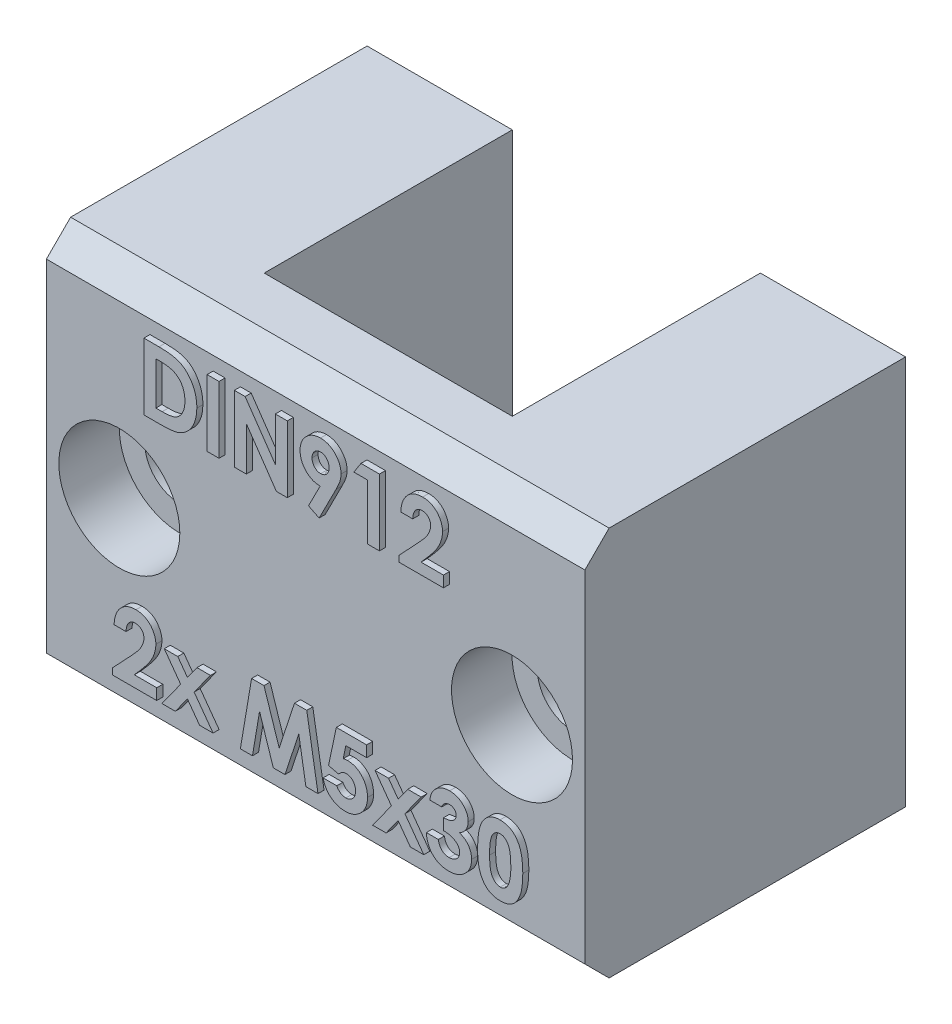
from build123d import *

# Parameters (mm, degrees)
SKETCH1_W                                           = 44.5
SKETCH1_H                                           = 32.2
BOSS_EXTRUDE1_DEPTH                                 = 6
SKETCH2_W                                           = 12
SKETCH2_H                                           = 32.2
BOSS_EXTRUDE2_DEPTH                                 = 20.5
CBORE_FOR_M5_HEX_SOCKET_HEAD_CAP_SCREW1_D           = 5.8
CBORE_FOR_M5_HEX_SOCKET_HEAD_CAP_SCREW1_CBORE_D     = 10
CBORE_FOR_M5_HEX_SOCKET_HEAD_CAP_SCREW1_CBORE_DEPTH = 5
SKETCH6_W                                           = 18.5
SKETCH6_H                                           = 30.2
CUT_EXTRUDE1_DEPTH                                  = 1
CHAMFER1_SIZE                                       = 2
SKETCH7_W                                           = 0.987179487
SKETCH7_H                                           = 5.5
BOSS_EXTRUDE3_DEPTH                                 = 0.5


with BuildPart() as part:
    # Sketch1 → Boss-Extrude1 (new body)
    with BuildSketch(Plane.XY):
        with Locations((22.25, 16.1)):
            Rectangle(SKETCH1_W, SKETCH1_H)
    extrude(amount=BOSS_EXTRUDE1_DEPTH)

    # Sketch2 → Boss-Extrude2 (add)
    with BuildSketch(Plane(origin=(0, 0, 0), x_dir=(-1, 0, 0), z_dir=(0, 0, -1))):
        with Locations((-38.5, 16.1)):
            Rectangle(SKETCH2_W, SKETCH2_H)
        with Locations((-6, 16.1)):
            Rectangle(SKETCH2_W, SKETCH2_H)
    extrude(amount=BOSS_EXTRUDE2_DEPTH)

    # CBORE for M5 Hex Socket Head Cap Screw1 (through all)
    with Locations(Plane.XY.offset(6)):
        with Locations((6.025, 16.1), (38.475, 16.1)):
            CounterBoreHole(CBORE_FOR_M5_HEX_SOCKET_HEAD_CAP_SCREW1_D / 2, CBORE_FOR_M5_HEX_SOCKET_HEAD_CAP_SCREW1_CBORE_D / 2, CBORE_FOR_M5_HEX_SOCKET_HEAD_CAP_SCREW1_CBORE_DEPTH)

    # Sketch6 → Cut-Extrude1 (cut)
    with BuildSketch(Plane(origin=(0, 0, 0), x_dir=(-1, 0, 0), z_dir=(0, 0, -1))):
        with Locations((-22.25, 16.1)):
            Rectangle(SKETCH6_W, SKETCH6_H)
    extrude(amount=-CUT_EXTRUDE1_DEPTH, mode=Mode.SUBTRACT)

    # Chamfer1
    chamfer1_edges = [part.edges().sort_by_distance(p)[0] for p in [
        (22.25, 0, 6),
        (22.25, 32.2, 6),
    ]]
    chamfer(chamfer1_edges, length=CHAMFER1_SIZE)

    # Sketch7 → Boss-Extrude3 (add)
    # profile 1 of 13: a face of its own
    with BuildSketch(Plane.XY.offset(6)):
        with BuildLine():
            Line((8.558580457, 29.075557716), (9.802470681, 29.075557716))
            add(Edge.make_bspline(
                [(9.802470681, 29.075557716), (9.899446232, 29.074879824), (10.086901067, 29.07356945), (10.358486038, 29.058804693), (10.611025501, 29.036097544), (10.844682249, 29.004859746), (11.058977246, 28.963523584), (11.253634165, 28.911675471), (11.429306319, 28.85182545), (11.587919919, 28.781399756), (11.73271888, 28.69929039), (11.870210114, 28.607827149), (12.000123662, 28.503659466), (12.124282653, 28.388796945), (12.241084791, 28.261138209), (12.352475248, 28.122797751), (12.455726682, 27.971769442), (12.55396016, 27.811674467), (12.642799269, 27.641834356), (12.720288059, 27.463694754), (12.785200889, 27.278402056), (12.837945924, 27.085758787), (12.879989805, 26.886404466), (12.909407061, 26.679936812), (12.927593101, 26.466546982), (12.929437923, 26.321922217), (12.930375329, 26.248434319)],
                knots=[0, 0, 0, 0, 1.44355588, 2.790409838, 4.047694926, 5.217575253, 6.298404546, 7.294384826, 8.214239204, 9.058592145, 9.873746385, 10.689560431, 11.514393297, 12.350027578, 13.205127629, 14.088021785, 14.991911688, 15.926770944, 16.882954281, 17.842803888, 18.816321264, 19.80318086, 20.814351908, 21.847355356, 22.906180909, 24, 24, 24, 24], degree=3))
            add(Edge.make_bspline(
                [(12.930375329, 26.248434319), (12.927920695, 26.144738112), (12.923088604, 25.940606058), (12.88238577, 25.641044621), (12.816555505, 25.353885105), (12.723992173, 25.081373785), (12.609238421, 24.825937413), (12.472152214, 24.592080503), (12.314743555, 24.381058279), (12.138846264, 24.193921461), (11.948392339, 24.03307483), (11.750472304, 23.89532146), (11.54315806, 23.786691434), (11.360485237, 23.717803753), (11.20208511, 23.674961575), (11.063011513, 23.649641436), (10.905038096, 23.626421341), (10.726691895, 23.608477351), (10.528755276, 23.592475721), (10.310439262, 23.583781059), (10.072450696, 23.576557085), (9.907145136, 23.575899568), (9.821200649, 23.575557716)],
                knots=[0, 0, 0, 0, 1.315458931, 2.589557908, 3.828601765, 5.048913369, 6.235739168, 7.376350998, 8.481830359, 9.569842114, 10.627874879, 11.640079404, 12.624025415, 13.590060155, 14.111227486, 14.704434459, 15.382649715, 16.137166398, 16.978595427, 17.902333227, 18.909396075, 20, 20, 20, 20], degree=3))
            Line((9.821200649, 23.575557716), (8.558580457, 23.575557716))
            Line((8.558580457, 23.575557716), (8.558580457, 29.075557716))
        make_face()
        with BuildLine():
            Line((9.545759944, 28.088378229), (9.545759944, 24.562737203))
            Line((9.545759944, 24.562737203), (10.061384944, 24.562737203))
            add(Edge.make_bspline(
                [(10.061384944, 24.562737203), (10.1227364, 24.562849625), (10.240735675, 24.563065848), (10.411099916, 24.573364761), (10.568643643, 24.58370203), (10.712933173, 24.603322512), (10.845018601, 24.625178347), (10.96308542, 24.655593736), (11.069567498, 24.687542524), (11.163164179, 24.728217292), (11.248891112, 24.773999451), (11.328264461, 24.827638557), (11.404881965, 24.887202761), (11.477311199, 24.954443932), (11.545826289, 25.028471669), (11.610021857, 25.109667406), (11.670754745, 25.197783411), (11.726466054, 25.293285575), (11.777375346, 25.395165374), (11.822537593, 25.502435954), (11.859983759, 25.615990648), (11.891106721, 25.734766447), (11.913347605, 25.859797429), (11.931747695, 25.990157507), (11.941233478, 26.126363156), (11.942535343, 26.219042033), (11.943195842, 26.266062524)],
                knots=[0, 0, 0, 0, 1.50275155, 2.890291501, 4.180787663, 5.369391935, 6.45668281, 7.458360028, 8.354766181, 9.177074746, 9.954075863, 10.732690366, 11.5210699, 12.329727389, 13.151100085, 13.990027547, 14.863562427, 15.770965086, 16.696477834, 17.652329173, 18.619756807, 19.62365428, 20.657822005, 21.729286259, 22.847956731, 24, 24, 24, 24], degree=3))
            add(Edge.make_bspline(
                [(11.943195842, 26.266062524), (11.941880352, 26.338116982), (11.939315248, 26.478617591), (11.914577947, 26.683259796), (11.874310339, 26.875961089), (11.816852342, 27.056006303), (11.744424757, 27.22390146), (11.65376475, 27.378224133), (11.54877398, 27.52156673), (11.465750143, 27.605656097), (11.424265553, 27.647673101)],
                knots=[0, 0, 0, 0, 1.13821349, 2.219428113, 3.251817212, 4.244760574, 5.201143372, 6.134805572, 7.068016741, 8, 8, 8, 8], degree=3))
            add(Edge.make_bspline(
                [(11.424265553, 27.647673101), (11.383357819, 27.683477269), (11.299808405, 27.756603227), (11.15312309, 27.844226826), (10.99148347, 27.921212746), (10.811191714, 27.982253995), (10.613990264, 28.030528017), (10.398704582, 28.06382143), (10.16648757, 28.085215424), (10.005613035, 28.087301374), (9.922562829, 28.088378229)],
                knots=[0, 0, 0, 0, 0.813307809, 1.661089106, 2.549956539, 3.493439533, 4.508053171, 5.589449661, 6.755572447, 8, 8, 8, 8], degree=3))
            Line((9.922562829, 28.088378229), (9.545759944, 28.088378229))
        make_face(mode=Mode.SUBTRACT)
    # profile 2 of 13: a face of its own
    with BuildSketch(Plane.XY.offset(6)):
        with Locations((14.270118918, 26.325557716)):
            Rectangle(SKETCH7_W, SKETCH7_H)
    # profile 3 of 13: a face of its own
    with BuildSketch(Plane.XY.offset(6)):
        Polygon((16.032939431, 29.075557716), (16.922062027, 29.075557716), (19.417554816, 25.456266851), (19.417554816, 29.075557716), (20.404734303, 29.075557716), (20.404734303, 23.575557716), (19.50900113, 23.575557716), (17.020118919, 27.183830953), (17.020118919, 23.575557716), (16.032939431, 23.575557716), align=None)
    # profile 4 of 13: a face of its own
    with BuildSketch(Plane.XY.offset(6)):
        with BuildLine():
            Line((23.035743919, 23.434532075), (22.160944239, 23.875237203))
            Line((22.160944239, 23.875237203), (23.119477893, 25.761455152))
            add(Edge.make_bspline(
                [(23.119477893, 25.761455152), (23.062845524, 25.762898636), (22.951662483, 25.765732544), (22.787954127, 25.789282293), (22.631403769, 25.829483218), (22.480166194, 25.883000777), (22.33633297, 25.954746609), (22.198160005, 26.040371496), (22.067560079, 26.143248566), (21.943920864, 26.258886646), (21.831034309, 26.386704156), (21.733051168, 26.524169725), (21.64764759, 26.667796254), (21.581233083, 26.820826216), (21.527888613, 26.980407512), (21.488912454, 27.147366153), (21.467040064, 27.322434646), (21.463982923, 27.441584348), (21.462426611, 27.502240409)],
                knots=[0, 0, 0, 0, 1.014336294, 1.991387562, 2.955278539, 3.906441712, 4.859855302, 5.829322156, 6.813833455, 7.833278715, 8.858926674, 9.863225732, 10.85404919, 11.846815163, 12.845559416, 13.865450493, 14.913355531, 16, 16, 16, 16], degree=3))
            add(Edge.make_bspline(
                [(21.462426611, 27.502240409), (21.463870175, 27.56107619), (21.466714689, 27.677010879), (21.490338649, 27.847165275), (21.529217574, 28.010538353), (21.582558065, 28.167102361), (21.653567833, 28.315801558), (21.73668296, 28.45896423), (21.838287431, 28.593628495), (21.953065917, 28.720377315), (22.078684878, 28.836330106), (22.211956052, 28.938280945), (22.352273473, 29.023502051), (22.497833924, 29.095072058), (22.651268515, 29.148544715), (22.810359945, 29.188889439), (22.976293339, 29.21217411), (23.088925467, 29.215101847), (23.145920201, 29.216583357)],
                knots=[0, 0, 0, 0, 1.055538678, 2.079917126, 3.075849687, 4.065898488, 5.041806164, 6.028602842, 7.031727914, 8.062953097, 9.093756959, 10.095582084, 11.068815425, 12.035667573, 13.000833448, 13.979119574, 14.977382875, 16, 16, 16, 16], degree=3))
            add(Edge.make_bspline(
                [(23.145920201, 29.216583357), (23.20551509, 29.215356661), (23.322700375, 29.212944528), (23.494243897, 29.186327599), (23.658369794, 29.14549236), (23.815744939, 29.090029775), (23.964415584, 29.014755568), (24.105625728, 28.924538906), (24.238905663, 28.817383686), (24.362824059, 28.696378455), (24.475526456, 28.564762626), (24.575423107, 28.426992605), (24.659340535, 28.28333777), (24.728074042, 28.135080192), (24.781617098, 27.981987608), (24.818421125, 27.823842861), (24.842854917, 27.660916387), (24.845634995, 27.550440197), (24.847041995, 27.494528069)],
                knots=[0, 0, 0, 0, 1.062826075, 2.08990367, 3.089830715, 4.078784409, 5.060762809, 6.057138927, 7.064407536, 8.107320944, 9.143871033, 10.153461498, 11.140480137, 12.108246174, 13.065926856, 14.029354859, 15.002654194, 16, 16, 16, 16], degree=3))
            add(Edge.make_bspline(
                [(24.847041995, 27.494528069), (24.846274182, 27.451885216), (24.844727633, 27.365992922), (24.829520792, 27.237188118), (24.806448948, 27.108026318), (24.779669191, 26.999433279), (24.75159434, 26.907895943), (24.724274313, 26.830243489), (24.689221915, 26.744034686), (24.650082408, 26.648691695), (24.604754253, 26.544632607), (24.552297654, 26.432354864), (24.495882943, 26.310193275), (24.454299732, 26.226660846), (24.432779175, 26.183430312)],
                knots=[0, 0, 0, 0, 1.105131805, 2.225983929, 3.357782449, 4.505488967, 5.122909461, 5.839607681, 6.638776516, 7.535249922, 8.51168636, 9.581005249, 10.748097757, 12, 12, 12, 12], degree=3))
            Line((24.432779175, 26.183430312), (23.035743919, 23.434532075))
        make_face()
        with BuildLine():
            add(Edge.make_bspline(
                [(23.167955457, 26.678121819), (23.215256985, 26.680906597), (23.307673461, 26.686347423), (23.440423583, 26.728417047), (23.559228193, 26.800409599), (23.664529031, 26.896052663), (23.751546421, 27.012741576), (23.814813757, 27.145581531), (23.853784489, 27.291821559), (23.857797584, 27.393653336), (23.859862508, 27.446050505)],
                knots=[0, 0, 0, 0, 0.984774978, 1.924027336, 2.867853169, 3.859505234, 4.871392407, 5.881338128, 6.909850265, 8, 8, 8, 8], degree=3))
            add(Edge.make_bspline(
                [(23.859862508, 27.446050505), (23.857375533, 27.499537656), (23.852537771, 27.603582935), (23.813193716, 27.753333284), (23.745962639, 27.888698718), (23.654498604, 28.006368558), (23.547715536, 28.104843182), (23.428305112, 28.176776243), (23.299166866, 28.221257342), (23.209798681, 28.22666961), (23.164650169, 28.22940387)],
                knots=[0, 0, 0, 0, 1.104110315, 2.147758178, 3.172670271, 4.206310416, 5.210906102, 6.157051016, 7.068948237, 8, 8, 8, 8], degree=3))
            add(Edge.make_bspline(
                [(23.164650169, 28.22940387), (23.116930725, 28.226738319), (23.023233987, 28.221504533), (22.888835053, 28.177130251), (22.764940334, 28.106578545), (22.656745891, 28.007769801), (22.56310775, 27.891649635), (22.497811318, 27.755827282), (22.456502531, 27.60712195), (22.451946243, 27.502890084), (22.449606098, 27.449355793)],
                knots=[0, 0, 0, 0, 0.970967322, 1.90648639, 2.855811969, 3.858352357, 4.877096915, 5.878517833, 6.91039038, 8, 8, 8, 8], degree=3))
            add(Edge.make_bspline(
                [(22.449606098, 27.449355793), (22.452050524, 27.396584594), (22.456804677, 27.293950122), (22.496649316, 27.14688071), (22.561552239, 27.013337754), (22.650279165, 26.895728583), (22.759568888, 26.799614275), (22.883658955, 26.728388589), (23.022078554, 26.686233351), (23.118454507, 26.680874335), (23.167955457, 26.678121819)],
                knots=[0, 0, 0, 0, 1.075706617, 2.092137047, 3.084482865, 4.090466434, 5.0784141, 6.035155512, 6.990809768, 8, 8, 8, 8], degree=3))
        make_face(mode=Mode.SUBTRACT)
    # profile 5 of 13: a face of its own
    with BuildSketch(Plane.XY.offset(6)):
        Polygon((26.494177412, 29.075557716), (28.020118919, 29.075557716), (28.020118919, 23.575557716), (27.032939431, 23.575557716), (27.032939431, 28.15889105), (25.904734303, 28.15889105), align=None)
    # profile 6 of 13: a face of its own
    with BuildSketch(Plane.XY.offset(6)):
        with BuildLine():
            Line((30.770118919, 27.242224383), (29.782939431, 27.242224383))
            add(Edge.make_bspline(
                [(29.782939431, 27.242224383), (29.787202908, 27.316899288), (29.795533486, 27.462809571), (29.828670418, 27.674748927), (29.873072771, 27.875008314), (29.932333605, 28.0628872), (30.00679872, 28.238317319), (30.094551937, 28.401896719), (30.197835152, 28.552764152), (30.314450157, 28.69019205), (30.442417152, 28.813479886), (30.579079415, 28.922794626), (30.72652738, 29.012998399), (30.882067052, 29.087227753), (31.045671946, 29.146533557), (31.218890021, 29.186184286), (31.400221462, 29.213036149), (31.524357516, 29.215385795), (31.587626931, 29.216583357)],
                knots=[0, 0, 0, 0, 1.199038563, 2.342849363, 3.436047546, 4.486744587, 5.497670872, 6.488682221, 7.459191391, 8.424610317, 9.374430501, 10.305433194, 11.225809216, 12.140057399, 13.06607119, 14.010487599, 14.985989317, 16, 16, 16, 16], degree=3))
            add(Edge.make_bspline(
                [(31.587626931, 29.216583357), (31.665289241, 29.214160088), (31.816904268, 29.2094293), (32.037212929, 29.169074103), (32.242957131, 29.101573801), (32.433987317, 29.007258078), (32.608677213, 28.887439838), (32.76699785, 28.744576196), (32.904161362, 28.575669799), (33.021037403, 28.387748565), (33.118147425, 28.188766426), (33.186198084, 27.983010644), (33.230927049, 27.775941141), (33.23569767, 27.636511018), (33.238067636, 27.567244415)],
                knots=[0, 0, 0, 0, 1.075374347, 2.099382735, 3.09057751, 4.06680945, 5.040638231, 6.016817125, 7.011024321, 8.044445721, 9.0776792, 10.070479129, 11.0414456, 12, 12, 12, 12], degree=3))
            add(Edge.make_bspline(
                [(33.238067636, 27.567244415), (33.237144897, 27.525347078), (33.235287649, 27.441018087), (33.222373963, 27.313407626), (33.20300088, 27.183421452), (33.173790994, 27.051171017), (33.137363871, 26.916619247), (33.093172505, 26.779363477), (33.040191835, 26.640181895), (32.979306, 26.497508037), (32.906669044, 26.350878697), (32.822093406, 26.198095843), (32.723334256, 26.039295007), (32.611584481, 25.873579547), (32.486301337, 25.701210822), (32.346873236, 25.52270806), (32.19490606, 25.337442275), (32.08705068, 25.213602494), (32.031637348, 25.149976787)],
                knots=[0, 0, 0, 0, 0.728284026, 1.46585585, 2.227944881, 3.01186502, 3.81876927, 4.650621989, 5.517437689, 6.406905708, 7.346299482, 8.360816762, 9.441613733, 10.596154504, 11.834900912, 13.145207542, 14.533280747, 16, 16, 16, 16], degree=3))
            Line((32.031637348, 25.149976787), (31.457618919, 24.492224383))
            Line((31.457618919, 24.492224383), (33.308580457, 24.492224383))
            Line((33.308580457, 24.492224383), (33.308580457, 23.575557716))
            Line((33.308580457, 23.575557716), (29.64191379, 23.575557716))
            Line((29.64191379, 23.575557716), (29.64191379, 24.075758037))
            Line((29.64191379, 24.075758037), (31.270319239, 25.808830953))
            add(Edge.make_bspline(
                [(31.270319239, 25.808830953), (31.317465761, 25.859385229), (31.408774594, 25.957293867), (31.538697652, 26.10108312), (31.656266544, 26.237535688), (31.759043381, 26.368104517), (31.85242176, 26.488554485), (31.932237948, 26.602516104), (31.999222198, 26.70895912), (32.071943102, 26.837310808), (32.141004056, 26.990393036), (32.204371661, 27.166750039), (32.242998602, 27.335306718), (32.248330341, 27.445141874), (32.250888149, 27.497833357)],
                knots=[0, 0, 0, 0, 1.246127091, 2.413378631, 3.493388633, 4.492180848, 5.408488754, 6.240484944, 6.999099869, 7.674939598, 8.898438119, 10.020720584, 11.050475521, 12, 12, 12, 12], degree=3))
            add(Edge.make_bspline(
                [(32.250888149, 27.497833357), (32.248975738, 27.548808302), (32.245270134, 27.647580431), (32.204548553, 27.788083259), (32.141461268, 27.915294226), (32.052562373, 28.025412127), (31.944877968, 28.115903307), (31.820438523, 28.183208105), (31.680258586, 28.222042665), (31.581989779, 28.226903364), (31.531437027, 28.22940387)],
                knots=[0, 0, 0, 0, 1.062038974, 2.057870785, 3.028805853, 4.01125022, 4.991535629, 5.949134679, 6.94496649, 8, 8, 8, 8], degree=3))
            add(Edge.make_bspline(
                [(31.531437027, 28.22940387), (31.505320832, 28.228480153), (31.453906908, 28.226661668), (31.378332458, 28.214556506), (31.306417939, 28.193222421), (31.237362902, 28.16463775), (31.171904322, 28.126748564), (31.110207305, 28.080044105), (31.051621796, 28.025711241), (30.99641649, 27.963919862), (30.946172456, 27.894960664), (30.901545888, 27.81946345), (30.864647145, 27.737475083), (30.832160151, 27.650077934), (30.807104627, 27.556333286), (30.788861097, 27.456802191), (30.774991759, 27.351646573), (30.771772747, 27.279361974), (30.770118919, 27.242224383)],
                knots=[0, 0, 0, 0, 0.903469896, 1.778625579, 2.63899355, 3.493148037, 4.358286772, 5.247621495, 6.164656832, 7.118446693, 8.109501108, 9.111810964, 10.146451449, 11.215617525, 12.33435995, 13.498009769, 14.714554818, 16, 16, 16, 16], degree=3))
        make_face()
    # profile 7 of 13: a face of its own
    with BuildSketch(Plane.XY.offset(6)):
        with BuildLine():
            Line((7.077811226, 7.331967973), (6.090631739, 7.331967973))
            add(Edge.make_bspline(
                [(6.090631739, 7.331967973), (6.094895216, 7.406642878), (6.103225794, 7.55255316), (6.136362726, 7.764492517), (6.180765078, 7.964751903), (6.240025912, 8.15263079), (6.314491027, 8.328060908), (6.402244245, 8.491640309), (6.505527459, 8.642507742), (6.622142465, 8.77993564), (6.75010946, 8.903223476), (6.886771723, 9.012538216), (7.034219688, 9.102741989), (7.18975936, 9.176971342), (7.353364254, 9.236277147), (7.526582329, 9.275927876), (7.707913769, 9.302779739), (7.832049824, 9.305129384), (7.895319239, 9.306326947)],
                knots=[0, 0, 0, 0, 1.199038563, 2.342849363, 3.436047546, 4.486744587, 5.497670872, 6.488682221, 7.459191391, 8.424610317, 9.374430501, 10.305433194, 11.225809216, 12.140057399, 13.06607119, 14.010487599, 14.985989317, 16, 16, 16, 16], degree=3))
            add(Edge.make_bspline(
                [(7.895319239, 9.306326947), (7.972981548, 9.303903678), (8.124596576, 9.29917289), (8.344905237, 9.258817693), (8.550649439, 9.191317391), (8.741679624, 9.097001668), (8.91636952, 8.977183427), (9.074690158, 8.834319786), (9.211853669, 8.665413388), (9.328729711, 8.477492155), (9.425839733, 8.278510016), (9.493890391, 8.072754233), (9.538619357, 7.865684731), (9.543389978, 7.726254608), (9.545759944, 7.656988005)],
                knots=[0, 0, 0, 0, 1.075374347, 2.099382735, 3.09057751, 4.06680945, 5.040638231, 6.016817125, 7.011024321, 8.044445721, 9.0776792, 10.070479129, 11.0414456, 12, 12, 12, 12], degree=3))
            add(Edge.make_bspline(
                [(9.545759944, 7.656988005), (9.544837204, 7.615090667), (9.542979957, 7.530761676), (9.53006627, 7.403151216), (9.510693188, 7.273165042), (9.481483302, 7.140914607), (9.445056178, 7.006362837), (9.400864813, 6.869107066), (9.347884142, 6.729925484), (9.286998307, 6.587251626), (9.214361352, 6.440622286), (9.129785714, 6.287839433), (9.031026564, 6.129038597), (8.919276788, 5.963323137), (8.793993645, 5.790954412), (8.654565543, 5.61245165), (8.502598367, 5.427185865), (8.394742988, 5.303346084), (8.339329656, 5.239720376)],
                knots=[0, 0, 0, 0, 0.728284026, 1.46585585, 2.227944881, 3.01186502, 3.81876927, 4.650621989, 5.517437689, 6.406905708, 7.346299482, 8.360816762, 9.441613733, 10.596154504, 11.834900912, 13.145207542, 14.533280747, 16, 16, 16, 16], degree=3))
            Line((8.339329656, 5.239720376), (7.765311226, 4.581967973))
            Line((7.765311226, 4.581967973), (9.616272765, 4.581967973))
            Line((9.616272765, 4.581967973), (9.616272765, 3.665301306))
            Line((9.616272765, 3.665301306), (5.949606098, 3.665301306))
            Line((5.949606098, 3.665301306), (5.949606098, 4.165501626))
            Line((5.949606098, 4.165501626), (7.578011547, 5.898574543))
            add(Edge.make_bspline(
                [(7.578011547, 5.898574543), (7.625158069, 5.949128818), (7.716466901, 6.047037457), (7.84638996, 6.190826709), (7.963958851, 6.327279278), (8.066735689, 6.457848107), (8.160114068, 6.578298074), (8.239930255, 6.692259694), (8.306914506, 6.79870271), (8.37963541, 6.927054398), (8.448696364, 7.080136626), (8.512063969, 7.256493629), (8.550690909, 7.425050308), (8.556022649, 7.534885463), (8.558580457, 7.587576947)],
                knots=[0, 0, 0, 0, 1.246127091, 2.413378631, 3.493388633, 4.492180848, 5.408488754, 6.240484944, 6.999099869, 7.674939598, 8.898438119, 10.020720584, 11.050475521, 12, 12, 12, 12], degree=3))
            add(Edge.make_bspline(
                [(8.558580457, 7.587576947), (8.556668046, 7.638551892), (8.552962442, 7.737324021), (8.512240861, 7.877826849), (8.449153576, 8.005037816), (8.360254681, 8.115155716), (8.252570276, 8.205646897), (8.128130831, 8.272951695), (7.987950893, 8.311786254), (7.889682086, 8.316646954), (7.839129335, 8.31914746)],
                knots=[0, 0, 0, 0, 1.062038974, 2.057870785, 3.028805853, 4.01125022, 4.991535629, 5.949134679, 6.94496649, 8, 8, 8, 8], degree=3))
            add(Edge.make_bspline(
                [(7.839129335, 8.31914746), (7.81301314, 8.318223743), (7.761599216, 8.316405258), (7.686024765, 8.304300096), (7.614110246, 8.282966011), (7.54505521, 8.25438134), (7.47959663, 8.216492154), (7.417899613, 8.169787695), (7.359314104, 8.11545483), (7.304108798, 8.053663451), (7.253864763, 7.984704254), (7.209238195, 7.90920704), (7.172339453, 7.827218673), (7.139852459, 7.739821523), (7.114796935, 7.646076876), (7.096553405, 7.546545781), (7.082684067, 7.441390163), (7.079465055, 7.369105564), (7.077811226, 7.331967973)],
                knots=[0, 0, 0, 0, 0.903469896, 1.778625579, 2.63899355, 3.493148037, 4.358286772, 5.247621495, 6.164656832, 7.118446693, 8.109501108, 9.111810964, 10.146451449, 11.215617525, 12.33435995, 13.498009769, 14.714554818, 16, 16, 16, 16], degree=3))
        make_face()
    # profile 8 of 13: a face of its own
    with BuildSketch(Plane.XY.offset(6)):
        Polygon((10.240972284, 7.684532075), (11.354854495, 7.684532075), (12.149225489, 6.589379832), (12.940291194, 7.684532075), (14.054173406, 7.684532075), (12.707819239, 5.81924762), (14.270118919, 3.665301306), (13.156236707, 3.665301306), (12.152530777, 5.049115409), (11.153231899, 3.665301306), (10.039349688, 3.665301306), (11.593937027, 5.81924762), align=None)
    # profile 9 of 13: a face of its own
    with BuildSketch(Plane.XY.offset(6)):
        Polygon((17.455315233, 9.165301306), (18.479954656, 9.165301306), (19.734862508, 5.328963165), (20.998584463, 9.165301306), (22.013308021, 9.165301306), (22.943195842, 3.665301306), (21.943896963, 3.665301306), (21.35665738, 7.139159479), (20.213027572, 3.665301306), (19.250086867, 3.665301306), (18.113067636, 7.139159479), (17.526929816, 3.665301306), (16.526529175, 3.665301306), align=None)
    # profile 10 of 13: a face of its own
    with BuildSketch(Plane.XY.offset(6)):
        with BuildLine():
            Line((24.45811972, 9.165301306), (26.962426611, 9.165301306))
            Line((26.962426611, 9.165301306), (26.962426611, 8.248634639))
            Line((26.962426611, 8.248634639), (25.240371322, 8.248634639))
            Line((25.240371322, 8.248634639), (25.025527572, 7.208570537))
            add(Edge.make_bspline(
                [(25.025527572, 7.208570537), (25.054803109, 7.216724143), (25.112540481, 7.23280473), (25.199521905, 7.248931525), (25.283819026, 7.2593844), (25.339134282, 7.260778674), (25.365972284, 7.261455152)],
                knots=[0, 0, 0, 0, 1.05461699, 2.079921384, 3.068411212, 4, 4, 4, 4], degree=3))
            add(Edge.make_bspline(
                [(25.365972284, 7.261455152), (25.424455101, 7.260115052), (25.539737615, 7.25747342), (25.708381305, 7.232395716), (25.869867601, 7.192899092), (26.023702337, 7.136568756), (26.169735237, 7.06325337), (26.308143321, 6.974562305), (26.439096462, 6.870339786), (26.560268381, 6.750520562), (26.671606203, 6.618956342), (26.768408088, 6.476655716), (26.851082939, 6.325647754), (26.916839657, 6.164993793), (26.968740465, 5.995702849), (27.006245148, 5.817666434), (27.02842354, 5.630673548), (27.03141416, 5.503101672), (27.032939431, 5.438037684)],
                knots=[0, 0, 0, 0, 1.01440847, 1.999622559, 2.951875003, 3.895578053, 4.836219714, 5.782137149, 6.743708247, 7.735272588, 8.734977101, 9.730283169, 10.717124674, 11.717316708, 12.737475749, 13.78628267, 14.87096371, 16, 16, 16, 16], degree=3))
            add(Edge.make_bspline(
                [(27.032939431, 5.438037684), (27.031075526, 5.372235069), (27.027397495, 5.242387275), (27.003401715, 5.051465087), (26.961048732, 4.868604732), (26.902872673, 4.693316697), (26.826229439, 4.526889308), (26.73405546, 4.367598501), (26.624792323, 4.216626641), (26.499512274, 4.075521372), (26.363316428, 3.946548447), (26.218300001, 3.833090718), (26.065481779, 3.737616959), (25.904858073, 3.66045802), (25.737350433, 3.599411241), (25.56290802, 3.5549721), (25.380683064, 3.529488721), (25.256975995, 3.526032445), (25.194097284, 3.524275665)],
                knots=[0, 0, 0, 0, 1.06808661, 2.107647099, 3.116961351, 4.110378221, 5.100014249, 6.085620622, 7.093190682, 8.119403071, 9.144090782, 10.133780668, 11.103064255, 12.062861538, 13.020824475, 13.992378307, 14.979551724, 16, 16, 16, 16], degree=3))
            add(Edge.make_bspline(
                [(25.194097284, 3.524275665), (25.137866724, 3.525712821), (25.026968293, 3.528547193), (24.863619772, 3.545968737), (24.706133658, 3.576770192), (24.555346031, 3.621347871), (24.409670352, 3.676212818), (24.270790674, 3.744831802), (24.13794383, 3.825898226), (24.011507053, 3.917932626), (23.893534763, 4.021605808), (23.785862157, 4.135093968), (23.687837372, 4.256966643), (23.601557984, 4.388727371), (23.527294454, 4.530181484), (23.46143604, 4.679661913), (23.407530268, 4.838729709), (23.380174642, 4.949004343), (23.366272765, 5.005044896)],
                knots=[0, 0, 0, 0, 1.054957082, 2.080596141, 3.077793124, 4.061112343, 5.027190972, 5.994718051, 6.962465889, 7.943658696, 8.924948258, 9.904494768, 10.875059, 11.855380583, 12.854004648, 13.869083016, 14.917087635, 16, 16, 16, 16], degree=3))
            Line((23.366272765, 5.005044896), (24.494477893, 5.005044896))
            add(Edge.make_bspline(
                [(24.494477893, 5.005044896), (24.51510151, 4.966211075), (24.555181156, 4.890741976), (24.631421503, 4.790545408), (24.716767732, 4.705102079), (24.810449973, 4.633577189), (24.913075228, 4.579991959), (25.020461712, 4.5393554), (25.133958477, 4.515873037), (25.211254785, 4.512937509), (25.250287188, 4.511455152)],
                knots=[0, 0, 0, 0, 1.104910296, 2.147267069, 3.153527244, 4.136738762, 5.099945312, 6.05603338, 7.018353, 8, 8, 8, 8], degree=3))
            add(Edge.make_bspline(
                [(25.250287188, 4.511455152), (25.277492249, 4.512478732), (25.331018666, 4.514492644), (25.409881376, 4.525146742), (25.485159298, 4.545325362), (25.557412105, 4.573268061), (25.626833886, 4.608115761), (25.692429455, 4.652108713), (25.755340059, 4.702746231), (25.814607941, 4.760852955), (25.86828756, 4.825628436), (25.915358713, 4.895234106), (25.957446815, 4.968123312), (25.988622116, 5.047183379), (26.014152052, 5.130053544), (26.032953329, 5.217358924), (26.044189212, 5.309201483), (26.045229354, 5.371899823), (26.045759944, 5.403883037)],
                knots=[0, 0, 0, 0, 0.978869489, 1.925942215, 2.855067702, 3.774946051, 4.70828698, 5.642468714, 6.60995405, 7.609372294, 8.622401667, 9.629904756, 10.629323, 11.642352373, 12.678539694, 13.745912462, 14.850161547, 16, 16, 16, 16], degree=3))
            add(Edge.make_bspline(
                [(26.045759944, 5.403883037), (26.045144133, 5.435123847), (26.043945443, 5.495934843), (26.034029636, 5.585227168), (26.016290449, 5.669949424), (25.992120654, 5.750750521), (25.961180432, 5.827139795), (25.923369411, 5.899571953), (25.878526061, 5.967680876), (25.826409626, 6.030079934), (25.770833195, 6.087314124), (25.711126251, 6.137370691), (25.64782672, 6.178914166), (25.582901558, 6.215182828), (25.513759186, 6.24157837), (25.441954338, 6.259756006), (25.367562526, 6.273094023), (25.316821486, 6.273877681), (25.291052412, 6.274275665)],
                knots=[0, 0, 0, 0, 1.166249705, 2.270133367, 3.348514167, 4.393962215, 5.415026464, 6.420877785, 7.440098956, 8.453121383, 9.451844239, 10.415694839, 11.355045125, 12.27538808, 13.187007209, 14.108269027, 15.039275622, 16, 16, 16, 16], degree=3))
            add(Edge.make_bspline(
                [(25.291052412, 6.274275665), (25.263061209, 6.273213554), (25.206960833, 6.271084857), (25.123609716, 6.253764213), (25.041263582, 6.225732914), (24.959464501, 6.187059294), (24.879024471, 6.136447729), (24.797820641, 6.077086166), (24.718571076, 6.004661424), (24.668181999, 5.950719312), (24.642114111, 5.922813325)],
                knots=[0, 0, 0, 0, 0.88288272, 1.769486374, 2.674910571, 3.623812639, 4.617874466, 5.670434592, 6.794841017, 8, 8, 8, 8], degree=3))
            Line((24.642114111, 5.922813325), (23.811384944, 6.113418293))
            Line((23.811384944, 6.113418293), (24.45811972, 9.165301306))
        make_face()
    # profile 11 of 13: a face of its own
    with BuildSketch(Plane.XY.offset(6)):
        Polygon((27.657638951, 7.684532075), (28.771521162, 7.684532075), (29.565892156, 6.589379832), (30.356957861, 7.684532075), (31.470840072, 7.684532075), (30.124485906, 5.81924762), (31.686785585, 3.665301306), (30.572903374, 3.665301306), (29.569197444, 5.049115409), (28.569898566, 3.665301306), (27.456016354, 3.665301306), (29.010603694, 5.81924762), align=None)
    # profile 12 of 13: a face of its own
    with BuildSketch(Plane.XY.offset(6)):
        with BuildLine():
            Line((33.167554816, 7.825557716), (32.180375329, 7.825557716))
            add(Edge.make_bspline(
                [(32.180375329, 7.825557716), (32.187345191, 7.874903297), (32.201009145, 7.97164204), (32.23370516, 8.11169564), (32.272813121, 8.244546065), (32.321637413, 8.369772604), (32.378900365, 8.487598327), (32.444019675, 8.598427555), (32.517699309, 8.701784588), (32.574175529, 8.764047275), (32.602350489, 8.795108998)],
                knots=[0, 0, 0, 0, 1.111473889, 2.178970933, 3.205615836, 4.199322666, 5.174200091, 6.12565194, 7.064921805, 8, 8, 8, 8], degree=3))
            add(Edge.make_bspline(
                [(32.602350489, 8.795108998), (32.642989136, 8.836092691), (32.723083637, 8.916867243), (32.856930943, 9.020330522), (32.997227637, 9.109870954), (33.146787433, 9.180859256), (33.303283066, 9.238316062), (33.467959045, 9.276909929), (33.640142443, 9.3025173), (33.757635952, 9.305039716), (33.81759488, 9.306326947)],
                knots=[0, 0, 0, 0, 1.01925491, 2.00884431, 2.983262333, 3.955970413, 4.92937149, 5.924503185, 6.940838805, 8, 8, 8, 8], degree=3))
            add(Edge.make_bspline(
                [(33.81759488, 9.306326947), (33.870901452, 9.305068483), (33.975691432, 9.302594597), (34.129706335, 9.282735582), (34.276546656, 9.247905081), (34.41776454, 9.202364983), (34.551283132, 9.140400069), (34.680049317, 9.068471992), (34.800465363, 8.980249216), (34.912813022, 8.880566358), (35.016025773, 8.772749589), (35.105408468, 8.657502329), (35.182252375, 8.537903099), (35.24556159, 8.412958256), (35.294237773, 8.282456376), (35.328020488, 8.147151353), (35.350132095, 8.007341747), (35.352334989, 7.912315041), (35.353452252, 7.864119415)],
                knots=[0, 0, 0, 0, 1.091422571, 2.145516843, 3.172569842, 4.178562979, 5.178154469, 6.181868002, 7.194278174, 8.227918432, 9.254613415, 10.245994977, 11.209837596, 12.161663635, 13.10878368, 14.055455738, 15.013766427, 16, 16, 16, 16], degree=3))
            add(Edge.make_bspline(
                [(35.353452252, 7.864119415), (35.351159561, 7.804433145), (35.346645957, 7.686929231), (35.309608572, 7.514953523), (35.251634992, 7.350514055), (35.167886517, 7.195911583), (35.063179593, 7.051566849), (34.934707704, 6.922305731), (34.786130062, 6.806101588), (34.674590848, 6.743653468), (34.617474688, 6.711675505)],
                knots=[0, 0, 0, 0, 0.992805628, 1.954529043, 2.915727527, 3.886831945, 4.871318353, 5.87440735, 6.911542536, 8, 8, 8, 8], degree=3))
            add(Edge.make_bspline(
                [(34.617474688, 6.711675505), (34.656678344, 6.698804119), (34.73371177, 6.673512423), (34.843205523, 6.623700715), (34.94732157, 6.569264774), (35.044267071, 6.50602456), (35.135006266, 6.436537228), (35.218985997, 6.360208774), (35.296708025, 6.27720563), (35.366903569, 6.187071311), (35.429204857, 6.091247339), (35.485104485, 5.991947191), (35.531112995, 5.887664962), (35.570087931, 5.779591627), (35.599761228, 5.666755878), (35.62065388, 5.549594946), (35.632730346, 5.428376081), (35.634572213, 5.346250373), (35.635503534, 5.304724383)],
                knots=[0, 0, 0, 0, 1.059543567, 2.081955587, 3.086750234, 4.076226789, 5.052108497, 6.020845489, 6.989030705, 7.970690546, 8.952259656, 9.923888338, 10.895517021, 11.877585046, 12.873342345, 13.889638361, 14.932918083, 16, 16, 16, 16], degree=3))
            add(Edge.make_bspline(
                [(35.635503534, 5.304724383), (35.633615622, 5.243698037), (35.629893045, 5.123366511), (35.606226639, 4.946130489), (35.562164057, 4.777151687), (35.504197289, 4.614485752), (35.426875912, 4.46023264), (35.33588165, 4.310852453), (35.224031419, 4.171525655), (35.099729094, 4.038568807), (34.961684114, 3.917690394), (34.812020898, 3.812894249), (34.654030413, 3.722960511), (34.486713096, 3.64994974), (34.310127078, 3.593723096), (34.124665953, 3.553079886), (33.929550464, 3.528213698), (33.796368878, 3.52560695), (33.728352092, 3.524275665)],
                knots=[0, 0, 0, 0, 1.005138573, 1.981928558, 2.936866704, 3.876260664, 4.820238198, 5.773547, 6.751179199, 7.756627054, 8.768222608, 9.766606018, 10.760583154, 11.757261445, 12.767156078, 13.807575856, 14.880313354, 16, 16, 16, 16], degree=3))
            add(Edge.make_bspline(
                [(33.728352092, 3.524275665), (33.664009309, 3.52567928), (33.538195512, 3.528423863), (33.354166502, 3.552179622), (33.179264348, 3.590499589), (33.013042696, 3.64451476), (32.856144645, 3.714563207), (32.707147381, 3.797975189), (32.569024114, 3.899561716), (32.440235877, 4.014736981), (32.323639582, 4.143957088), (32.219429952, 4.284228718), (32.129904827, 4.436085267), (32.054697065, 4.59887794), (31.994394619, 4.772892325), (31.946828227, 4.957774553), (31.913602324, 5.153885829), (31.903483305, 5.288814559), (31.898324047, 5.357608998)],
                knots=[0, 0, 0, 0, 1.066544725, 2.085487077, 3.070979577, 4.031932826, 4.977951092, 5.916076795, 6.857635327, 7.814973522, 8.776389752, 9.738577119, 10.707772778, 11.69409279, 12.707140348, 13.757286496, 14.856535458, 16, 16, 16, 16], degree=3))
            Line((31.898324047, 5.357608998), (32.885503534, 5.357608998))
            add(Edge.make_bspline(
                [(32.885503534, 5.357608998), (32.891759187, 5.323018251), (32.903943713, 5.2556437), (32.927708883, 5.158100327), (32.958678215, 5.068061769), (32.994486468, 4.984727766), (33.033164773, 4.907004171), (33.079897413, 4.837761509), (33.131260068, 4.775119558), (33.205376754, 4.700650116), (33.311331661, 4.624135873), (33.454405888, 4.557641356), (33.613562417, 4.5186674), (33.724828703, 4.513912697), (33.78233847, 4.511455152)],
                knots=[0, 0, 0, 0, 0.928156231, 1.807827665, 2.648129825, 3.438902246, 4.202261636, 4.936546065, 5.639352463, 6.338805438, 7.70633318, 9.064371875, 10.482673459, 12, 12, 12, 12], degree=3))
            add(Edge.make_bspline(
                [(33.78233847, 4.511455152), (33.812855185, 4.511978463), (33.872630603, 4.513003512), (33.960431791, 4.524364809), (34.044074785, 4.543076874), (34.123715375, 4.568505876), (34.199860557, 4.600382721), (34.271055501, 4.641486004), (34.338751339, 4.689274439), (34.402212155, 4.743001326), (34.460851256, 4.8015444), (34.509642438, 4.866370909), (34.554234047, 4.932246228), (34.587214322, 5.003480154), (34.616112148, 5.07623954), (34.633799094, 5.153165323), (34.647154009, 5.232643808), (34.647930143, 5.287035394), (34.648324047, 5.314640248)],
                knots=[0, 0, 0, 0, 1.110435564, 2.175094844, 3.216326037, 4.226890168, 5.215276772, 6.21526065, 7.213097102, 8.228249917, 9.239874822, 10.221364777, 11.178138315, 12.128914389, 13.072518965, 14.022636769, 14.996447288, 16, 16, 16, 16], degree=3))
            add(Edge.make_bspline(
                [(34.648324047, 5.314640248), (34.647278305, 5.344830859), (34.645196473, 5.404933449), (34.62818769, 5.49264054), (34.601327225, 5.577007693), (34.564014758, 5.65766129), (34.514188118, 5.734304058), (34.455393238, 5.808473684), (34.382998055, 5.87630977), (34.303570843, 5.943363685), (34.211466481, 6.001814476), (34.111170579, 6.055755967), (34.000047206, 6.098676741), (33.880808983, 6.137012942), (33.751200407, 6.165013108), (33.612026299, 6.185343958), (33.463511168, 6.200477124), (33.361137758, 6.202648226), (33.308580457, 6.203762844)],
                knots=[0, 0, 0, 0, 0.809814727, 1.612155564, 2.388397, 3.182215007, 3.988903953, 4.837162975, 5.715530372, 6.646997145, 7.623086902, 8.637258368, 9.698941581, 10.815059213, 11.996518529, 13.252603015, 14.589518788, 16, 16, 16, 16], degree=3))
            Line((33.308580457, 6.203762844), (33.308580457, 7.120429511))
            add(Edge.make_bspline(
                [(33.308580457, 7.120429511), (33.374017423, 7.126002332), (33.496437027, 7.136427978), (33.666362002, 7.160808711), (33.809416927, 7.193397576), (33.929040128, 7.232714278), (34.02836757, 7.283207165), (34.115139475, 7.338949084), (34.189871544, 7.403685175), (34.253030167, 7.475485019), (34.303555101, 7.552591318), (34.339313705, 7.633805613), (34.362926819, 7.716615032), (34.36516416, 7.773254179), (34.366272765, 7.801318934)],
                knots=[0, 0, 0, 0, 1.70044513, 3.18119609, 4.440695891, 5.496282586, 6.431922213, 7.318171381, 8.16090191, 8.983045123, 9.787564368, 10.536848927, 11.275007137, 12, 12, 12, 12], degree=3))
            add(Edge.make_bspline(
                [(34.366272765, 7.801318934), (34.364360104, 7.837126515), (34.360626996, 7.907015332), (34.331633656, 8.007040952), (34.281304503, 8.096205501), (34.213821947, 8.174321353), (34.131592105, 8.239569568), (34.035204315, 8.286938659), (33.926750199, 8.314770115), (33.850446884, 8.317655299), (33.810984303, 8.31914746)],
                knots=[0, 0, 0, 0, 1.009664648, 1.970651636, 2.907870547, 3.878035693, 4.867062054, 5.849714035, 6.887914197, 8, 8, 8, 8], degree=3))
            add(Edge.make_bspline(
                [(33.810984303, 8.31914746), (33.775215911, 8.317386867), (33.704240465, 8.313893312), (33.600453119, 8.28781834), (33.50188972, 8.243924369), (33.410591235, 8.183397171), (33.327875578, 8.110706572), (33.259989888, 8.024619645), (33.20352579, 7.930294008), (33.179592146, 7.860606678), (33.167554816, 7.825557716)],
                knots=[0, 0, 0, 0, 0.98818071, 1.960853194, 2.938124878, 3.957524365, 4.978590984, 5.968022688, 6.978025184, 8, 8, 8, 8], degree=3))
        make_face()
    # profile 13 of 13: a face of its own
    with BuildSketch(Plane.XY.offset(6)):
        with BuildLine():
            add(Edge.make_bspline(
                [(37.981156579, 9.306326947), (38.028940163, 9.305617586), (38.122895457, 9.304222793), (38.261273919, 9.289116051), (38.394570638, 9.266293976), (38.523307086, 9.234465141), (38.646556605, 9.19234081), (38.765216231, 9.141918709), (38.877873571, 9.080554093), (38.985965366, 9.011239608), (39.08944998, 8.932765785), (39.18584023, 8.843301575), (39.27689641, 8.744905553), (39.360647487, 8.636090148), (39.438948154, 8.517845151), (39.511541129, 8.390151812), (39.577870695, 8.252385159), (39.638680248, 8.104296579), (39.693056341, 7.94366629), (39.738857258, 7.768651792), (39.778139208, 7.579213118), (39.811295945, 7.374878725), (39.836357079, 7.155377006), (39.853248789, 6.920853785), (39.864840679, 6.67176119), (39.865786728, 6.500885716), (39.866272765, 6.41309778)],
                knots=[0, 0, 0, 0, 0.879237366, 1.728815576, 2.559023295, 3.367336655, 4.166867292, 4.954216142, 5.737608147, 6.525189134, 7.316157332, 8.124696809, 8.942788509, 9.781158001, 10.649253743, 11.551476218, 12.482711956, 13.461909668, 14.496590415, 15.601789533, 16.789733467, 18.056700938, 19.410929216, 20.8549011, 22.384193279, 24, 24, 24, 24], degree=3))
            add(Edge.make_bspline(
                [(39.866272765, 6.41309778), (39.865747491, 6.324211519), (39.864726892, 6.151507108), (39.853730667, 5.900136185), (39.834794647, 5.663910185), (39.810388538, 5.442853547), (39.776958844, 5.237083008), (39.737808026, 5.04606576), (39.691284156, 4.869871042), (39.635116931, 4.708895859), (39.57467546, 4.560547204), (39.508164454, 4.423049162), (39.436743191, 4.296029314), (39.36204986, 4.177571392), (39.279989496, 4.071167475), (39.19455621, 3.973199275), (39.102030083, 3.887398524), (39.006306823, 3.809343438), (38.9038797, 3.74188818), (38.795805018, 3.682892923), (38.680155993, 3.635040763), (38.55904071, 3.59342151), (38.430394735, 3.563543377), (38.296262233, 3.539836061), (38.155128877, 3.526733943), (38.059039604, 3.52510854), (38.009802412, 3.524275665)],
                knots=[0, 0, 0, 0, 1.643780988, 3.193836972, 4.651895693, 6.025988579, 7.305620092, 8.505800249, 9.631074763, 10.672816429, 11.65661981, 12.592235626, 13.49536222, 14.350718032, 15.179365177, 15.97804903, 16.751647189, 17.51006938, 18.259804725, 19.016521909, 19.783502495, 20.571750527, 21.382245291, 22.22305063, 23.089471752, 24, 24, 24, 24], degree=3))
            add(Edge.make_bspline(
                [(38.009802412, 3.524275665), (37.960566549, 3.525124605), (37.864114217, 3.526787667), (37.722599223, 3.539738641), (37.587755886, 3.563639416), (37.458092114, 3.593650892), (37.334510346, 3.634948677), (37.21641801, 3.684232539), (37.104723135, 3.742859695), (36.999116455, 3.810472117), (36.899958541, 3.888004955), (36.80570848, 3.974628909), (36.716574759, 4.070124407), (36.633913322, 4.17556108), (36.556370414, 4.289531567), (36.484754686, 4.413337356), (36.419109176, 4.546798188), (36.35738048, 4.690100095), (36.303746058, 4.846328202), (36.256013912, 5.016877606), (36.216912994, 5.203169977), (36.185465419, 5.405145467), (36.160357693, 5.622376182), (36.141680431, 5.854966973), (36.130623126, 6.103026175), (36.129613231, 6.27352962), (36.129093277, 6.361314928)],
                knots=[0, 0, 0, 0, 0.917216111, 1.796812873, 2.643793957, 3.46689424, 4.273913431, 5.068098542, 5.848489301, 6.620921603, 7.401012384, 8.190319798, 9.003608147, 9.831726257, 10.68377682, 11.569763213, 12.493818149, 13.453288342, 14.474581811, 15.568529029, 16.750744269, 18.018426408, 19.375425659, 20.823733699, 22.36466933, 24, 24, 24, 24], degree=3))
            add(Edge.make_bspline(
                [(36.129093277, 6.361314928), (36.130035126, 6.483285702), (36.131852433, 6.718629881), (36.154882694, 7.058633795), (36.188685275, 7.372908516), (36.23833326, 7.660928339), (36.299722307, 7.923760008), (36.378334177, 8.159672123), (36.467828074, 8.371929059), (36.544088371, 8.497671346), (36.580816034, 8.558229992)],
                knots=[0, 0, 0, 0, 1.288568992, 2.486310467, 3.599230591, 4.627010532, 5.572937695, 6.447898582, 7.252493626, 8, 8, 8, 8], degree=3))
            add(Edge.make_bspline(
                [(36.580816034, 8.558229992), (36.623521211, 8.617722787), (36.707018248, 8.734042925), (36.85301515, 8.886749522), (37.009869814, 9.017351682), (37.180803943, 9.12289376), (37.363114144, 9.206124252), (37.558365642, 9.264909011), (37.765837407, 9.299159751), (37.908311729, 9.303902205), (37.981156579, 9.306326947)],
                knots=[0, 0, 0, 0, 1.058512271, 2.069600068, 3.047294572, 4.004278952, 4.967380941, 5.939006123, 6.946246673, 8, 8, 8, 8], degree=3))
        make_face()
        with BuildLine():
            add(Edge.make_bspline(
                [(38.005395361, 8.31914746), (37.962198604, 8.317100019), (37.877510031, 8.313085949), (37.754622876, 8.279012158), (37.638747962, 8.226383351), (37.55060501, 8.16305281), (37.484630887, 8.102342892), (37.438534294, 8.04740239), (37.394081395, 7.98609275), (37.354818356, 7.915647382), (37.317743799, 7.838597472), (37.281510781, 7.75459326), (37.251809221, 7.661571419), (37.222628225, 7.561116125), (37.19706295, 7.450450055), (37.175644854, 7.328668637), (37.156509668, 7.194979913), (37.143162648, 7.049296319), (37.130719219, 6.891770275), (37.121799181, 6.722050874), (37.118069936, 6.540183903), (37.116884523, 6.414934819), (37.116272765, 6.3502973)],
                knots=[0, 0, 0, 0, 1.076674018, 2.110852608, 3.161083442, 4.239746716, 4.804137807, 5.395870207, 6.026861976, 6.692161227, 7.405688833, 8.16177676, 8.973626916, 9.841385931, 10.773283133, 11.807421078, 12.927755683, 14.143907515, 15.458935494, 16.872852025, 18.386167141, 20, 20, 20, 20], degree=3))
            add(Edge.make_bspline(
                [(37.116272765, 6.3502973), (37.117279645, 6.266556269), (37.119210412, 6.105976633), (37.129322868, 5.875057525), (37.149592446, 5.664902544), (37.174803709, 5.474087389), (37.210213957, 5.303849549), (37.25095574, 5.152578416), (37.30126822, 5.02220233), (37.359413984, 4.910835759), (37.423813038, 4.816096448), (37.493721043, 4.735567607), (37.566757884, 4.66583343), (37.645203277, 4.609189218), (37.728870075, 4.565779704), (37.817059814, 4.534555777), (37.909828537, 4.515442311), (37.973355603, 4.512791888), (38.005395361, 4.511455152)],
                knots=[0, 0, 0, 0, 1.771748488, 3.397459088, 4.888034009, 6.237357457, 7.467047327, 8.564189669, 9.548206622, 10.417051504, 11.216568818, 11.965764335, 12.669334354, 13.348544111, 14.005342236, 14.656555988, 15.322436492, 16, 16, 16, 16], degree=3))
            add(Edge.make_bspline(
                [(38.005395361, 4.511455152), (38.036335616, 4.512369846), (38.096912789, 4.514160704), (38.185247873, 4.532543614), (38.268783806, 4.562430234), (38.347268366, 4.604706956), (38.420982281, 4.658468276), (38.489565283, 4.723950444), (38.552500134, 4.801806166), (38.589166264, 4.859586627), (38.608059624, 4.8893598)],
                knots=[0, 0, 0, 0, 0.992283464, 1.942767638, 2.88273346, 3.832339453, 4.79467288, 5.803907806, 6.868395428, 8, 8, 8, 8], degree=3))
            add(Edge.make_bspline(
                [(38.608059624, 4.8893598), (38.630303373, 4.930043889), (38.676946711, 5.015355125), (38.730922462, 5.159314655), (38.776356242, 5.321677211), (38.815460431, 5.502948082), (38.842205311, 5.703842222), (38.865237969, 5.923085743), (38.876347193, 6.161782668), (38.878154168, 6.327152759), (38.879093277, 6.41309778)],
                knots=[0, 0, 0, 0, 0.710965849, 1.490837728, 2.352621235, 3.297892224, 4.334225155, 5.461620853, 6.680770821, 8, 8, 8, 8], degree=3))
            add(Edge.make_bspline(
                [(38.879093277, 6.41309778), (38.87873052, 6.499788846), (38.878032274, 6.666654347), (38.865221474, 6.906209405), (38.847381457, 7.125003192), (38.821286662, 7.322547231), (38.787710965, 7.499321073), (38.746328792, 7.655313162), (38.697542289, 7.790830929), (38.63968731, 7.905739242), (38.575609326, 8.003395546), (38.50758859, 8.08717708), (38.435337483, 8.158707639), (38.358976831, 8.218256407), (38.276739241, 8.263756132), (38.190195559, 8.295882702), (38.099168362, 8.315318199), (38.037074927, 8.317853811), (38.005395361, 8.31914746)],
                knots=[0, 0, 0, 0, 1.793836731, 3.452829483, 4.963243077, 6.335886805, 7.574563692, 8.684454726, 9.672768357, 10.54971625, 11.340229787, 12.085688095, 12.778991901, 13.440269426, 14.083255152, 14.715733572, 15.344777694, 16, 16, 16, 16], degree=3))
        make_face(mode=Mode.SUBTRACT)
    extrude(amount=BOSS_EXTRUDE3_DEPTH)


solid = part.part
